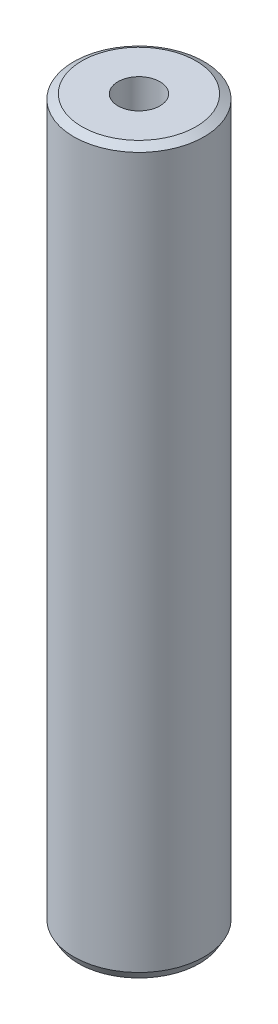
from build123d import *
from OCP.BRepFilletAPI import BRepFilletAPI_MakeChamfer

# Parameters (mm, degrees)
SKETCH1_R           = 25
BOSS_EXTRUDE1_DEPTH = 277.359548344
SKETCH2_R           = 8.058768064
CUT_EXTRUDE1_DEPTH  = 280.603860949
CHAMFER1_SIZE       = 1.79804764
CHAMFER1_SIZE2      = 3.114309868


with BuildPart() as part:
    # Sketch1 → Boss-Extrude1 (new body)
    with BuildSketch(Plane(origin=(0, 0, 0), x_dir=(1, 0, 0), z_dir=(0, 1, 0))):
        Circle(SKETCH1_R)
    extrude(amount=BOSS_EXTRUDE1_DEPTH)

    # Sketch2 → Cut-Extrude1 (cut, through all)
    with BuildSketch(Plane(origin=(0, 0, 0), x_dir=(1, 0, 0), z_dir=(0, 1, 0))):
        Circle(SKETCH2_R)
    extrude(amount=CUT_EXTRUDE1_DEPTH, mode=Mode.SUBTRACT)

    # Chamfer1: one chamfer whose edges measure the first distance from different faces: ONE call of the kernel's chamfer builder (chamfer() names one face for all edges)
    chamfer1_edges_1 = [part.edges().sort_by_distance(p)[0] for p in [
        (-25, 277.359548344, 0),
    ]]
    chamfer1_side_1 = [part.faces().sort_by_distance(p)[0] for p in [
        (-25, 138.679774172, 0),
    ]]
    chamfer1_edges_2 = [part.edges().sort_by_distance(p)[0] for p in [
        (-25, 0, 0),
    ]]
    chamfer1_side_2 = [part.faces().sort_by_distance(p)[0] for p in [
        (-24.292893219, 0, 0),
    ]]
    chamfer1 = BRepFilletAPI_MakeChamfer(part.part.solid().wrapped)
    for e in chamfer1_edges_1:
        chamfer1.Add(CHAMFER1_SIZE, CHAMFER1_SIZE2, e.wrapped, chamfer1_side_1[0].wrapped)  # the first distance lies on this face
    for e in chamfer1_edges_2:
        chamfer1.Add(CHAMFER1_SIZE, CHAMFER1_SIZE2, e.wrapped, chamfer1_side_2[0].wrapped)  # the first distance lies on this face
    add(Compound.cast(chamfer1.Shape()), mode=Mode.REPLACE)


solid = part.part
